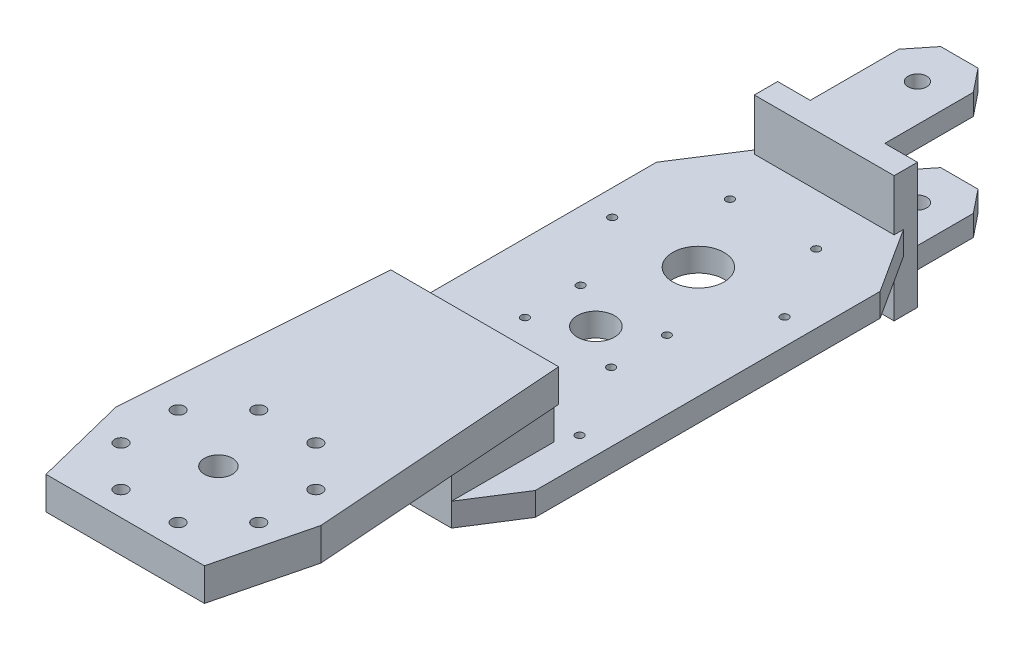
from build123d import *

# Parameters (mm, degrees)
SK_KNEE_PLATE_R         = 2.75
SK_KNEE_PLATE_R_2       = 6
KNEE_PLATE_DEPTH        = 14
SK_KNEE_PILOT_RECESS_R  = 25.15
KNEE_PILOT_RECESS_DEPTH = 2.2
SK_JOGGLE_W             = 68
SK_JOGGLE_H             = 39
JOGGLE_DEPTH            = 44
SK_WEB_R                = 1.7
SK_WEB_R_2              = 11
SK_WEB_R_3              = 8
WEB_DEPTH               = 10
SK_FORK_BAR_W           = 60
SK_FORK_BAR_H           = 54
FORK_BAR_DEPTH          = 10
SK_TINE_LAT_R           = 4
TINE_LAT_DEPTH          = 9
SK_TINE_MED_R           = 4
TINE_MED_DEPTH          = 9


with BuildPart() as part:
    # SK_Knee_Plate → Knee_Plate (new body)
    with BuildSketch(Plane(origin=(0, 20, 0), x_dir=(1, 0, 0), z_dir=(0, 1, 0))):
        Polygon((-34, -40), (34, -40), (44, 0), (36, 110), (-36, 110), (-44, 0), align=None)
        with Locations((29.56414504, 12.245869836)):
            Circle(SK_KNEE_PLATE_R, mode=Mode.SUBTRACT)
        with Locations((12.245869836, 29.56414504)):
            Circle(SK_KNEE_PLATE_R, mode=Mode.SUBTRACT)
        with Locations((-12.245869836, 29.56414504)):
            Circle(SK_KNEE_PLATE_R, mode=Mode.SUBTRACT)
        with Locations((-29.56414504, 12.245869836)):
            Circle(SK_KNEE_PLATE_R, mode=Mode.SUBTRACT)
        with Locations((-29.56414504, -12.245869836)):
            Circle(SK_KNEE_PLATE_R, mode=Mode.SUBTRACT)
        with Locations((-12.245869836, -29.56414504)):
            Circle(SK_KNEE_PLATE_R, mode=Mode.SUBTRACT)
        with Locations((12.245869836, -29.56414504)):
            Circle(SK_KNEE_PLATE_R, mode=Mode.SUBTRACT)
        with Locations((29.56414504, -12.245869836)):
            Circle(SK_KNEE_PLATE_R, mode=Mode.SUBTRACT)
        Circle(SK_KNEE_PLATE_R_2, mode=Mode.SUBTRACT)
    extrude(amount=KNEE_PLATE_DEPTH)

    # SK_Knee_Pilot_Recess → Knee_Pilot_Recess (cut)
    with BuildSketch(Plane(origin=(0, 20, 0), x_dir=(1, 0, 0), z_dir=(0, 1, 0))):
        Circle(SK_KNEE_PILOT_RECESS_R)
    extrude(amount=KNEE_PILOT_RECESS_DEPTH, mode=Mode.SUBTRACT)

    # SK_Joggle → Joggle (add)
    with BuildSketch(Plane.XY.offset(-110)):
        with Locations((0, 14.5)):
            Rectangle(SK_JOGGLE_W, SK_JOGGLE_H)
    extrude(amount=JOGGLE_DEPTH)

    # SK_Web → Web (add)
    with BuildSketch(Plane(origin=(0, -5, 0), x_dir=(1, 0, 0), z_dir=(0, 1, 0))):
        Polygon((-34, 66), (34, 66), (48, 88), (48, 236), (30, 264), (-30, 264), (-48, 236), (-48, 88), align=None)
        with Locations((37, 118)):
            Circle(SK_WEB_R, mode=Mode.SUBTRACT)
        with Locations((18.5, 150.04293994)):
            Circle(SK_WEB_R, mode=Mode.SUBTRACT)
        with Locations((-18.5, 150.04293994)):
            Circle(SK_WEB_R, mode=Mode.SUBTRACT)
        with Locations((-37, 118)):
            Circle(SK_WEB_R, mode=Mode.SUBTRACT)
        with Locations((-18.5, 85.95706006)):
            Circle(SK_WEB_R, mode=Mode.SUBTRACT)
        with Locations((18.5, 85.95706006)):
            Circle(SK_WEB_R, mode=Mode.SUBTRACT)
        with Locations((37, 206)):
            Circle(SK_WEB_R, mode=Mode.SUBTRACT)
        with Locations((18.5, 238.04293994)):
            Circle(SK_WEB_R, mode=Mode.SUBTRACT)
        with Locations((-18.5, 238.04293994)):
            Circle(SK_WEB_R, mode=Mode.SUBTRACT)
        with Locations((-37, 206)):
            Circle(SK_WEB_R, mode=Mode.SUBTRACT)
        with Locations((-18.5, 173.95706006)):
            Circle(SK_WEB_R, mode=Mode.SUBTRACT)
        with Locations((18.5, 173.95706006)):
            Circle(SK_WEB_R, mode=Mode.SUBTRACT)
        with Locations((0, 118)):
            Circle(SK_WEB_R_2, mode=Mode.SUBTRACT)
        with Locations((0, 206)):
            Circle(SK_WEB_R_2, mode=Mode.SUBTRACT)
        with Locations((0, 162)):
            Circle(SK_WEB_R_3, mode=Mode.SUBTRACT)
    extrude(amount=WEB_DEPTH)

    # SK_Fork_Bar → Fork_Bar (add)
    with BuildSketch(Plane.XY.offset(-270)):
        Rectangle(SK_FORK_BAR_W, SK_FORK_BAR_H)
    extrude(amount=FORK_BAR_DEPTH)

    # SK_Tine_Lat → Tine_Lat (add)
    with BuildSketch(Plane(origin=(0, -27, 0), x_dir=(1, 0, 0), z_dir=(0, 1, 0))):
        Polygon((-16, 260), (16, 260), (16, 308), (8, 318), (-8, 318), (-16, 308), align=None)
        with Locations((0, 300)):
            Circle(SK_TINE_LAT_R, mode=Mode.SUBTRACT)
    extrude(amount=TINE_LAT_DEPTH)

    # SK_Tine_Med → Tine_Med (add)
    with BuildSketch(Plane(origin=(0, 18, 0), x_dir=(1, 0, 0), z_dir=(0, 1, 0))):
        Polygon((-16, 260), (16, 260), (16, 308), (8, 318), (-8, 318), (-16, 308), align=None)
        with Locations((0, 300)):
            Circle(SK_TINE_MED_R, mode=Mode.SUBTRACT)
    extrude(amount=TINE_MED_DEPTH)


solid = part.part
